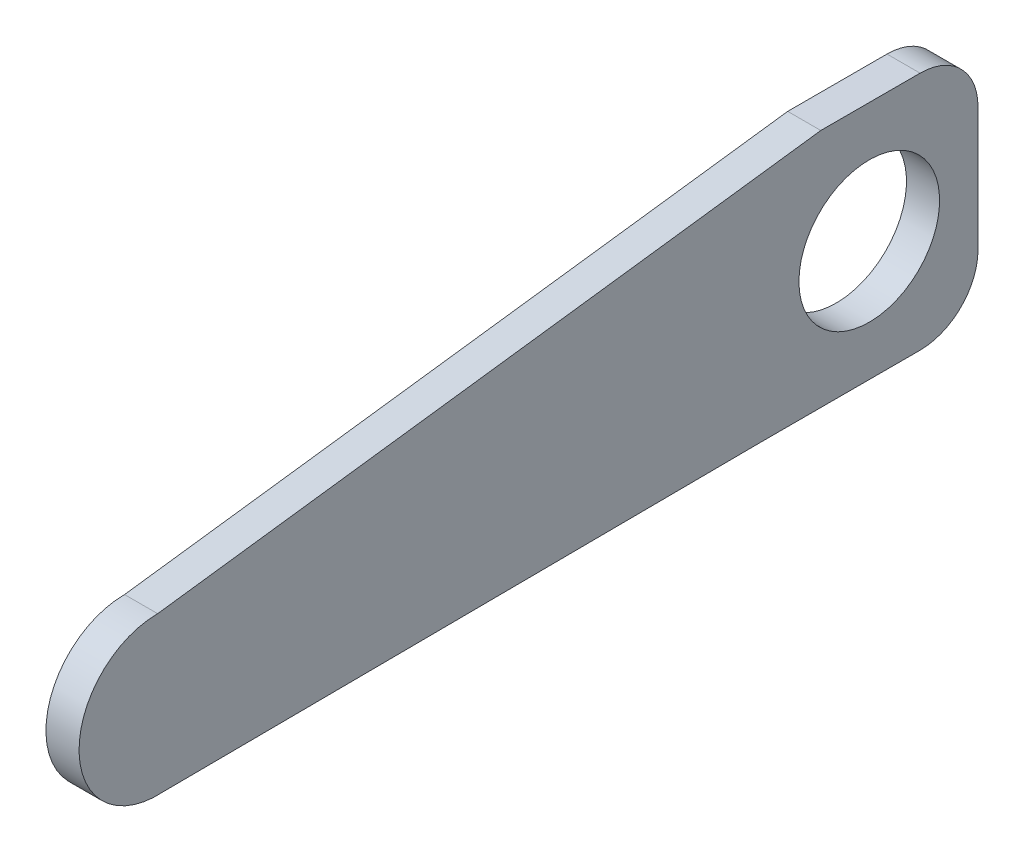
from build123d import *

# Parameters (mm, degrees)
SKETCH1_R           = 8.5
BOSS_EXTRUDE1_DEPTH = 4


with BuildPart() as part:
    # Sketch1 → Boss-Extrude1 (new body)
    with BuildSketch(Plane.ZY.offset(120)):
        with BuildLine():
            Line((11.536140352, -14.984859173), (-61.85712101, -14.5))
            Line((-61.85712101, -14.5), (-81.14287899, -14.5))
            ThreePointArc((-81.14287899, -14.5), (-86.092626458, -12.449747468), (-88.14287899, -7.5))
            Line((-88.14287899, -7.5), (-88.14287899, 7.5))
            ThreePointArc((-88.14287899, 7.5), (-86.092626458, 12.449747468), (-81.14287899, 14.5))
            Line((-81.14287899, 14.5), (-69.14287899, 14.5))
            Line((-69.14287899, 14.5), (11, 4))
            ThreePointArc((11, 4), (20.496214039, -5.231822949), (11.536140352, -14.984859173))
        make_face()
        with Locations((-75, 0)):
            Circle(SKETCH1_R, mode=Mode.SUBTRACT)
    extrude(amount=BOSS_EXTRUDE1_DEPTH)


solid = part.part
